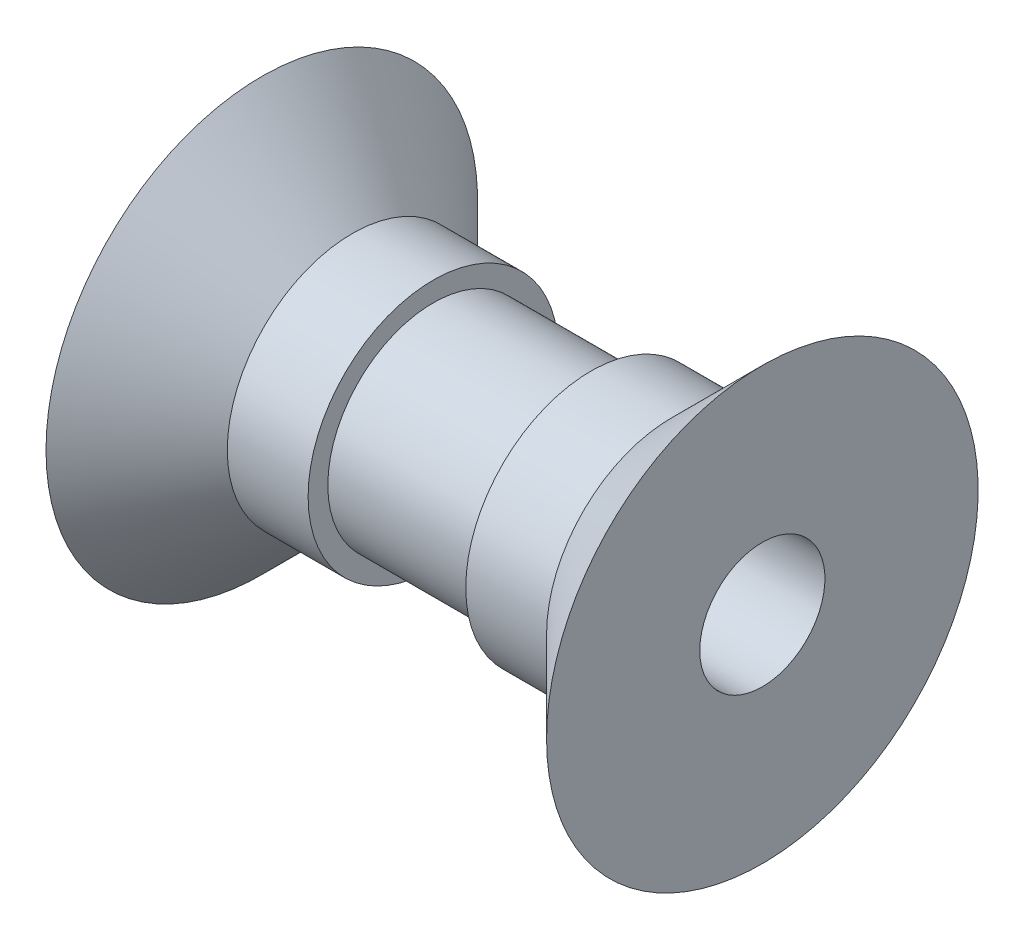
from build123d import *

# Parameters (mm, degrees)
SKETCH2_R          = 1.5875
CUT_EXTRUDE1_DEPTH = 15.87418065


with BuildPart() as part:
    # Sketch1 → Revolve1 (revolve)
    with BuildSketch(Plane.XY):
        Polygon((-6.35, 0), (-6.35, 5.475), (-4.05, 3.175), (-2, 3.175), (-2, 2.675), (2, 2.675), (2, 3.175), (4.05, 3.175), (6.35, 5.475), (6.35, 0), align=None)
    revolve(axis=Axis((-93.951812963, 0, 0), (1, 0, 0)))

    # Sketch2 → Cut-Extrude1 (cut, through all)
    with BuildSketch(Plane.ZY.offset(6.35)):
        Circle(SKETCH2_R)
    extrude(amount=-CUT_EXTRUDE1_DEPTH, mode=Mode.SUBTRACT)


solid = part.part
